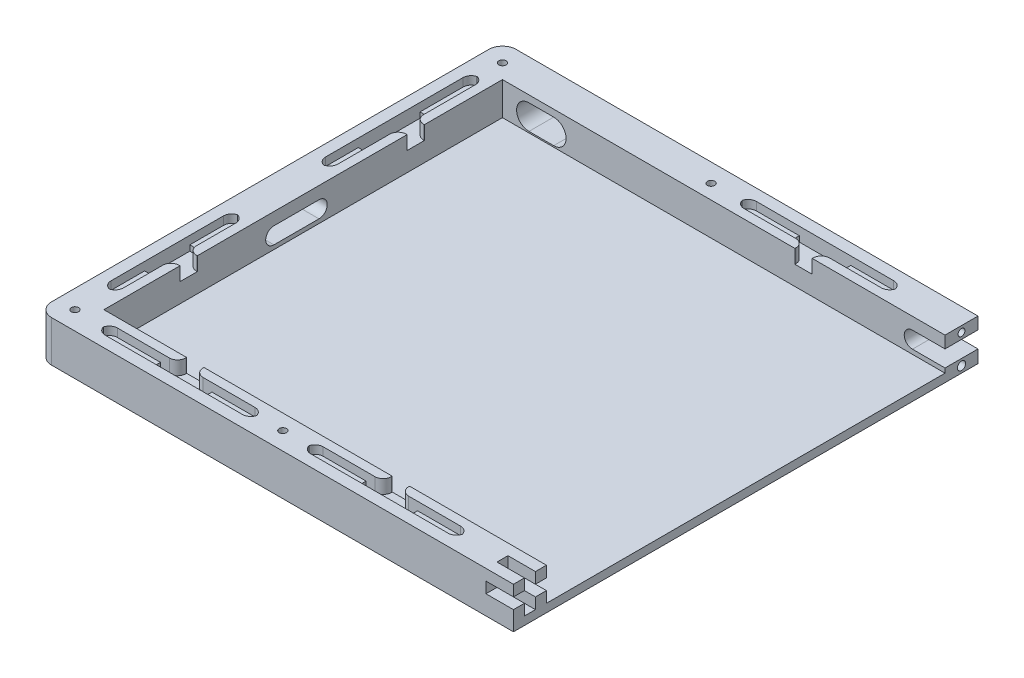
from build123d import *

# Parameters (mm, degrees)
SKETCH1_W           = 161
SKETCH1_H           = 145
BOSS_EXTRUDE1_DEPTH = 3
BOSS_EXTRUDE2_DEPTH = 15
CUT_EXTRUDE1_DEPTH  = 3
CUT_EXTRUDE2_DEPTH  = 2
CUT_EXTRUDE3_DEPTH  = 12
CUT_EXTRUDE5_DEPTH  = 12
CUT_EXTRUDE6_DEPTH  = 20
CUT_EXTRUDE8_DEPTH  = 10
FILLET2_R           = 5
FILLET3_R           = 5
SKETCH11_R          = 1.5
SKETCH11_R_2        = 1.25
CUT_EXTRUDE9_DEPTH  = 10
SKETCH12_R          = 1.325
CUT_EXTRUDE10_DEPTH = 17
SKETCH13_R          = 3
CUT_EXTRUDE11_DEPTH = 8
SKETCH14_R          = 6.25
CUT_EXTRUDE12_DEPTH = 1
FILLET5_R           = 3
FILLET6_R           = 3


with BuildPart() as part:
    # Sketch1 → Boss-Extrude1 (new body)
    with BuildSketch(Plane(origin=(0, 0, 0), x_dir=(1, 0, 0), z_dir=(0, 1, 0))):
        with Locations((-80.5, 0)):
            Rectangle(SKETCH1_W, SKETCH1_H)
    extrude(amount=BOSS_EXTRUDE1_DEPTH)

    # Sketch2 → Boss-Extrude2 (add)
    with BuildSketch(Plane(origin=(0, 0, 0), x_dir=(1, 0, 0), z_dir=(0, 1, 0))):
        Polygon((0, 72.5), (0, 84.5), (-173, 84.5), (-173, -84.5), (0, -84.5), (0, -72.5), (-161, -72.5), (-161, 72.5), align=None)
    extrude(amount=BOSS_EXTRUDE2_DEPTH)

    # Sketch3 → Cut-Extrude1 (cut)
    with BuildSketch(Plane(origin=(0, 15, 0), x_dir=(1, 0, 0), z_dir=(0, 1, 0))):
        Polygon((-161, 44.1), (-161, 37.8), (-164.3, 37.8), (-164.3, 12.95), (-168.8, 12.95), (-168.8, 68.95), (-164.3, 68.95), (-164.3, 44.1), align=None)
        Polygon((-24.95, -75.8), (-49.8, -75.8), (-49.8, -72.5), (-56.1, -72.5), (-56.1, -75.8), (-80.95, -75.8), (-80.95, -80.3), (-24.95, -80.3), align=None)
        Polygon((-161, -38.5), (-161, -44.8), (-164.3, -44.8), (-164.3, -65.1), (-168.8, -65.1), (-168.8, -18.2), (-164.3, -18.2), (-164.3, -38.5), align=None)
        Polygon((-99.75, -80.3), (-99.75, -75.8), (-124.6, -75.8), (-124.6, -72.5), (-130.9, -72.5), (-130.9, -75.8), (-155.75, -75.8), (-155.75, -80.3), align=None)
        Polygon((-48.3, 75.8), (-48.3, 72.5), (-54.6, 72.5), (-54.6, 75.8), (-79.45, 75.8), (-79.45, 80.3), (-23.45, 80.3), (-23.45, 75.8), align=None)
    extrude(amount=-CUT_EXTRUDE1_DEPTH, mode=Mode.SUBTRACT)

    # Sketch4 → Cut-Extrude2 (cut)
    with BuildSketch(Plane(origin=(0, 12, 0), x_dir=(1, 0, 0), z_dir=(0, 1, 0))):
        Polygon((-54.6, 72.5), (-48.3, 72.5), (-48.3, 75.8), (-42.0875, 75.8), (-42.0875, 80.3), (-60.8125, 80.3), (-60.8125, 75.8), (-54.6, 75.8), align=None)
        Polygon((-161, 44.1), (-161, 37.8), (-164.3, 37.8), (-164.3, 27.850226284), (-168.8, 27.850226284), (-168.8, 50.3125), (-164.3, 50.3125), (-164.3, 44.1), align=None)
        Polygon((-168.8, -33.425), (-168.8, -49.875), (-164.3, -49.875), (-164.3, -44.8), (-161, -44.8), (-161, -38.5), (-164.3, -38.5), (-164.3, -33.425), align=None)
        Polygon((-130.9, -72.5), (-130.9, -75.8), (-137.1125, -75.8), (-137.1125, -80.3), (-118.3875, -80.3), (-118.3875, -75.8), (-124.6, -75.8), (-124.6, -72.5), align=None)
        Polygon((-56.1, -75.8), (-62.3125, -75.8), (-62.3125, -80.3), (-43.5875, -80.3), (-43.5875, -75.8), (-49.8, -75.8), (-49.8, -72.5), (-56.1, -72.5), align=None)
    extrude(amount=-CUT_EXTRUDE2_DEPTH, mode=Mode.SUBTRACT)

    # Sketch5 → Cut-Extrude3 (cut)
    with BuildSketch(Plane.ZY.offset(173)):
        with BuildLine():
            Line((-5.75, 10.5), (10.63, 10.5))
            ThreePointArc((10.63, 10.5), (13.63, 7.5), (10.63, 4.5))
            Line((10.63, 4.5), (-5.75, 4.5))
            ThreePointArc((-5.75, 4.5), (-8.75, 7.5), (-5.75, 10.5))
        make_face()
    extrude(amount=-CUT_EXTRUDE3_DEPTH, mode=Mode.SUBTRACT)

    # Sketch7 → Cut-Extrude5 (cut)
    with BuildSketch(Plane(origin=(0, 0, -84.5), x_dir=(-1, 0, 0), z_dir=(0, 0, -1))):
        with BuildLine():
            Line((-4.5375, 10.634328206), (11.8425, 10.634328206))
            ThreePointArc((11.8425, 10.634328206), (14.8425, 7.634328206), (11.8425, 4.634328206))
            Line((11.8425, 4.634328206), (-4.5375, 4.634328206))
            ThreePointArc((-4.5375, 4.634328206), (-7.5375, 7.634328206), (-4.5375, 10.634328206))
        make_face()
    extrude(amount=-CUT_EXTRUDE5_DEPTH, mode=Mode.SUBTRACT)

    # Sketch8 → Cut-Extrude6 (cut)
    with BuildSketch(Plane(origin=(0, 0, -84.5), x_dir=(-1, 0, 0), z_dir=(0, 0, -1))):
        with BuildLine():
            Line((142.36, 12.5), (151.36, 12.5))
            ThreePointArc((151.36, 12.5), (155.86, 8), (151.36, 3.5))
            Line((151.36, 3.5), (142.36, 3.5))
            ThreePointArc((142.36, 3.5), (137.86, 8), (142.36, 12.5))
        make_face()
    extrude(amount=-CUT_EXTRUDE6_DEPTH, mode=Mode.SUBTRACT)

    # Sketch10 → Cut-Extrude8 (cut)
    with BuildSketch(Plane(origin=(0, 0, 0), x_dir=(0, 0, -1), z_dir=(1, 0, 0))):
        Polygon((-80.5, 15), (-76.5, 15), (-76.5, 11), (-72.5, 11), (-72.5, 7), (-76.5, 7), (-76.5, 3), (-80.5, 3), (-80.5, 7), (-84.5, 7), (-84.5, 11), (-80.5, 11), align=None)
    extrude(amount=-CUT_EXTRUDE8_DEPTH, mode=Mode.SUBTRACT)

    # Fillet2
    fillet2_edges = [part.edges().sort_by_distance(p)[0] for p in [
        (-173, 7.5, 84.5),
    ]]
    fillet(fillet2_edges, radius=FILLET2_R)

    # Fillet3
    fillet3_edges = [part.edges().sort_by_distance(p)[0] for p in [
        (-173, 7.5, -84.5),
    ]]
    fillet(fillet3_edges, radius=FILLET3_R)

    # Sketch11 → Cut-Extrude9 (cut)
    with BuildSketch(Plane(origin=(0, 0, 0), x_dir=(0, 0, -1), z_dir=(1, 0, 0))):
        with Locations((78.5, 2.317164103)):
            Circle(SKETCH11_R)
        with Locations((78.5, 12.817164103)):
            Circle(SKETCH11_R_2)
    extrude(amount=-CUT_EXTRUDE9_DEPTH, mode=Mode.SUBTRACT)

    # Sketch12 → Cut-Extrude10 (cut)
    with BuildSketch(Plane(origin=(0, 0, 0), x_dir=(-1, 0, 0), z_dir=(0, -1, 0))):
        with Locations(Location((166.267766953, -77.767766953, 0), (0, 0, 90))):
            Circle(SKETCH12_R)
        with Locations(Location((90.35, -78.05, 0), (0, 0, 90))):
            Circle(SKETCH12_R)
        with Locations((-80.0525, -78.05)):
            Circle(SKETCH12_R)
        with Locations((-164.807766953, -77.767766953)):
            Circle(SKETCH12_R)
        with Locations((-164.807766953, 77.767766953)):
            Circle(SKETCH12_R)
        with Locations((-80.0525, 78.05)):
            Circle(SKETCH12_R)
        with Locations(Location((90.35, 77.767766953, 0), (0, 0, 90))):
            Circle(SKETCH12_R)
        with Locations(Location((166.267766953, 77.767766953, 0), (0, 0, 90))):
            Circle(SKETCH12_R)
    extrude(amount=-CUT_EXTRUDE10_DEPTH, mode=Mode.SUBTRACT)

    # Sketch13 → Cut-Extrude11 (cut)
    with BuildSketch(Plane.XZ):
        with Locations(Location((-166.267766953, -77.767766953, 0), (0, 0, 270))):
            Circle(SKETCH13_R)
        with Locations(Location((-90.35, -77.767766953, 0), (0, 0, 270))):
            Circle(SKETCH13_R)
        with Locations(Location((-166.267766953, 77.767766953, 0), (0, 0, 270))):
            Circle(SKETCH13_R)
        with Locations(Location((-90.35, 78.05, 0), (0, 0, 270))):
            Circle(SKETCH13_R)
    extrude(amount=-CUT_EXTRUDE11_DEPTH, mode=Mode.SUBTRACT)

    # Sketch14 → Cut-Extrude12 (cut)
    with BuildSketch(Plane(origin=(0, 0, 0), x_dir=(-1, 0, 0), z_dir=(0, -1, 0))):
        with Locations(Location((153, -64.5, 0), (0, 0, 90))):
            Circle(SKETCH14_R)
        with Locations(Location((153, 64.5, 0), (0, 0, 90))):
            Circle(SKETCH14_R)
    extrude(amount=-CUT_EXTRUDE12_DEPTH, mode=Mode.SUBTRACT)

    # Fillet5
    fillet5_edges = [part.edges().sort_by_distance(p)[0] for p in [
        (-164.3, 12.5, -44.1),
        (-164.3, 12.5, -37.8),
        (-56.1, 12.5, 75.8),
        (-49.8, 12.5, 75.8),
        (-164.3, 12.5, 38.5),
        (-164.3, 12.5, 44.8),
        (-130.9, 12.5, 75.8),
        (-124.6, 12.5, 75.8),
        (-48.3, 12.5, -75.8),
        (-54.6, 12.5, -75.8),
    ]]
    fillet(fillet5_edges, radius=FILLET5_R)

    # Fillet6
    # the kernel refuses this fillet: 3 mm, written as the material it adds along each edge
    with BuildSketch(Plane(origin=(-168.8, 15, -12.95), x_dir=(0, 0, -1), z_dir=(0, -1, 0)), Plane(origin=(-164.3, 15, -12.95), x_dir=(-1, 0, 0), z_dir=(0, -1, 0)), Plane(origin=(-164.3, 15, -68.95), x_dir=(0, 0, 1), z_dir=(0, -1, 0)), Plane(origin=(-168.8, 15, -68.95), x_dir=(1, 0, 0), z_dir=(0, -1, 0)), Plane(origin=(-168.8, 15, 18.2), x_dir=(1, 0, 0), z_dir=(0, -1, 0)), Plane(origin=(-164.3, 15, 18.2), x_dir=(0, 0, 1), z_dir=(0, -1, 0)), Plane(origin=(-168.8, 15, 65.1), x_dir=(0, 0, -1), z_dir=(0, -1, 0)), Plane(origin=(-164.3, 15, 65.1), x_dir=(-1, 0, 0), z_dir=(0, -1, 0)), Plane(origin=(-23.45, 15, -75.8), x_dir=(-1, 0, 0), z_dir=(0, -1, 0)), Plane(origin=(-23.45, 15, -80.3), x_dir=(0, 0, 1), z_dir=(0, -1, 0)), Plane(origin=(-79.45, 15, -75.8), x_dir=(0, 0, -1), z_dir=(0, -1, 0)), Plane(origin=(-79.45, 15, -80.3), x_dir=(1, 0, 0), z_dir=(0, -1, 0))) as fillet6_piece_1:
        with BuildLine():
            CenterArc((FILLET6_R, FILLET6_R), FILLET6_R, 180, 90)
            Line((0, FILLET6_R), (0, 0))
            Line((0, 0), (FILLET6_R, 0))
        make_face()
    extrude(amount=10.5)
    with BuildSketch(Plane(origin=(-155.75, 15, 75.8), x_dir=(0, 0, 1), z_dir=(0, -1, 0)), Plane(origin=(-155.75, 15, 80.3), x_dir=(1, 0, 0), z_dir=(0, -1, 0)), Plane(origin=(-99.75, 15, 80.3), x_dir=(0, 0, -1), z_dir=(0, -1, 0)), Plane(origin=(-99.75, 15, 75.8), x_dir=(-1, 0, 0), z_dir=(0, -1, 0)), Plane(origin=(-80.95, 15, 80.3), x_dir=(1, 0, 0), z_dir=(0, -1, 0)), Plane(origin=(-80.95, 15, 75.8), x_dir=(0, 0, 1), z_dir=(0, -1, 0)), Plane(origin=(-24.95, 15, 80.3), x_dir=(0, 0, -1), z_dir=(0, -1, 0)), Plane(origin=(-24.95, 15, 75.8), x_dir=(-1, 0, 0), z_dir=(0, -1, 0))) as fillet6_piece_2:
        with BuildLine():
            CenterArc((FILLET6_R, -FILLET6_R), FILLET6_R, 90, 90)
            Line((0, -FILLET6_R), (0, 0))
            Line((0, 0), (FILLET6_R, 0))
        make_face()
    extrude(amount=10.5)


solid = part.part
